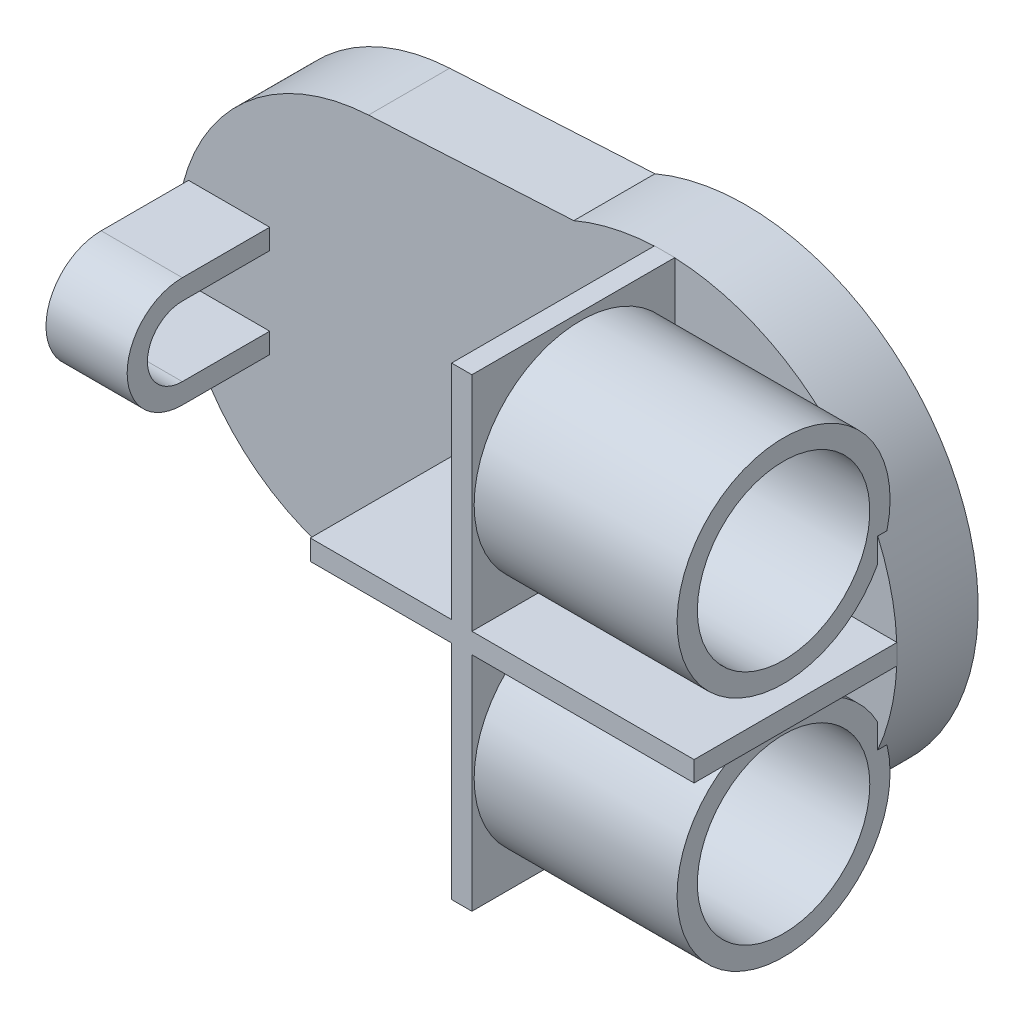
from build123d import *

# Parameters (mm, degrees)
EXTRUDE_THIN1_DEPTH     = 3
BOSS_EXTRUDE1_DEPTH     = 1
EXTRUDE_THIN2_OUTLINE_W = 18.914434681
EXTRUDE_THIN2_OUTLINE_H = 1
EXTRUDE_THIN2_DEPTH     = 10
SKETCH4_4_W             = 1
SKETCH4_4_H             = 22.9
EXTRUDE_THIN3_DEPTH     = 10
SKETCH5_R               = 5.249261594
SKETCH5_R_2             = 4.249261594
EXTRUDE_THIN4_DEPTH     = 10
SKETCH5_4_R             = 1.494593426
SKETCH5_4_R_2           = 1.433178879
CUT_EXTRUDE1_DEPTH      = 10
EXTRUDE_THIN5_START     = 12
EXTRUDE_THIN5_DEPTH     = 4


# Read off the part's stored shape, not the designer's step: Extrude-Thin1, Extrude-Thin2
with BuildPart() as part:
    # Extrude-Thin1 outline → Extrude-Thin1 (new body)
    with BuildSketch(Plane.XY):
        with BuildLine():
            Line((-2.95492513, -17.245283727), (-13.072339205, -17.798123277))
            ThreePointArc((-13.072339205, -17.798123277), (-22.52672937, -27.783227678), (-13.072339205, -37.76833208))
            Line((-13.072339205, -37.76833208), (-2.95492513, -38.32117163))
            ThreePointArc((-2.95492513, -38.32117163), (12.97327063, -27.783227679), (-2.95492513, -17.245283727))
        make_face()
        with BuildLine():
            ThreePointArc((-12.635851337, -29.780248558), (-14.52672937, -27.783227678), (-12.635851337, -25.786206798))
            Line((-12.635851337, -25.786206798), (-0.685801573, -25.133227678))
            ThreePointArc((-0.685801573, -25.133227678), (4.97327063, -27.783227678), (-0.685801573, -30.433227678))
            Line((-0.685801573, -30.433227678), (-12.635851337, -29.780248558))
        make_face(mode=Mode.SUBTRACT)
    extrude(amount=EXTRUDE_THIN1_DEPTH)

    # Sketch3 → Boss-Extrude1 (add)
    with BuildSketch(Plane.XY.offset(3)):
        with BuildLine():
            Line((-2.95492513, -17.245283727), (-13.072339205, -17.798123277))
            ThreePointArc((-13.072339205, -17.798123277), (-22.52672937, -27.783227678), (-13.072339205, -37.76833208))
            Line((-13.072339205, -37.76833208), (-2.95492513, -38.32117163))
            ThreePointArc((-2.95492513, -38.32117163), (12.97327063, -27.783227678), (-2.95492513, -17.245283727))
        make_face()
    extrude(amount=BOSS_EXTRUDE1_DEPTH)

    # Extrude-Thin2 outline → Extrude-Thin2 (add)
    with BuildSketch(Plane.XY.offset(4)):
        with Locations((3.516053289, -27.783227678)):
            Rectangle(EXTRUDE_THIN2_OUTLINE_W, EXTRUDE_THIN2_OUTLINE_H)
    extrude(amount=EXTRUDE_THIN2_DEPTH)

    # Sketch4<4> → Extrude-Thin3 (add)
    with BuildSketch(Plane.XY.offset(4)):
        with Locations((1.52327063, -27.783227678)):
            Rectangle(SKETCH4_4_W, SKETCH4_4_H)
        Polygon((12.97327063, -27.283227678), (-2.95492513, -27.283227678), (-5.941164051, -27.283227678), (-5.941164051, -28.283227678), (-2.95492513, -28.283227678), (12.97327063, -28.283227678), align=None)
    extrude(amount=EXTRUDE_THIN3_DEPTH)

    # Sketch5 → Extrude-Thin4 (add)
    # profile 1 of 2: a face of its own
    with BuildSketch(Plane(origin=(2.02327063, 0, 0), x_dir=(0, 0, -1), z_dir=(1, 0, 0))):
        with Locations((-8.640362386, -33.615627273)):
            Circle(SKETCH5_R)
        with Locations((-8.640362386, -33.615627273)):
            Circle(SKETCH5_R_2, mode=Mode.SUBTRACT)
    # profile 2 of 2: a face of its own
    with BuildSketch(Plane(origin=(2.02327063, 0, 0), x_dir=(0, 0, -1), z_dir=(1, 0, 0))):
        with Locations((-8.640362386, -21.950828084)):
            Circle(SKETCH5_R)
        with Locations((-8.640362386, -21.950828084)):
            Circle(SKETCH5_R_2, mode=Mode.SUBTRACT)
    extrude(amount=EXTRUDE_THIN4_DEPTH)

    # Sketch5<4> → Cut-Extrude1 (cut)
    with BuildSketch(Plane(origin=(2.02327063, 0, 0), x_dir=(0, 0, -1), z_dir=(1, 0, 0))):
        with Locations(Location((-8.640362386, -36.205301228, 0), (0, 0, 90))):
            Circle(SKETCH5_4_R)
        with Locations(Location((-8.640362386, -30.946846255, 0), (0, 0, 90))):
            Circle(SKETCH5_4_R_2)
        with Locations(Location((-8.640362386, -24.619609101, 0), (0, 0, 90))):
            Circle(SKETCH5_4_R_2)
        with Locations(Location((-8.640362386, -19.361154128, 0), (0, 0, 90))):
            Circle(SKETCH5_4_R)
    extrude(amount=-CUT_EXTRUDE1_DEPTH, mode=Mode.SUBTRACT)

    # Sketch6 → Extrude-Thin5 (add)
    with BuildSketch(Plane.ZY.offset(5.941164051).offset(EXTRUDE_THIN5_START)):
        with BuildLine():
            Line((4, -25.018913287), (8.306214493, -25.018913287))
            ThreePointArc((8.306214493, -25.018913287), (11.024963262, -27.737662056), (8.306214493, -30.456410826))
            Line((8.306214493, -30.456410826), (4, -30.456410826))
            Line((4, -30.456410826), (4, -29.456410826))
            Line((4, -29.456410826), (8.306214493, -29.456410826))
            ThreePointArc((8.306214493, -29.456410826), (10.024963262, -27.737662056), (8.306214493, -26.018913287))
            Line((8.306214493, -26.018913287), (4, -26.018913287))
            Line((4, -26.018913287), (4, -25.018913287))
        make_face()
    extrude(amount=EXTRUDE_THIN5_DEPTH)


solid = part.part
